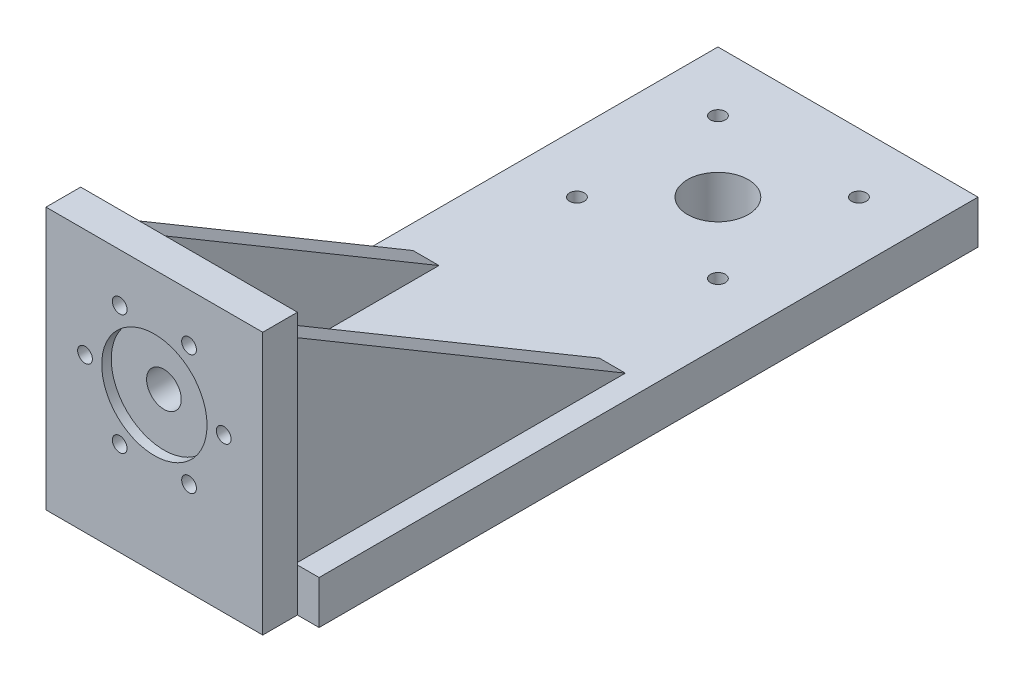
from build123d import *

# Parameters (mm, degrees)
SK_YAW_PLATE_W         = 50
SK_YAW_PLATE_H         = 60.5
SK_YAW_PLATE_R         = 1.7
SK_YAW_PLATE_R_2       = 4
YAW_PLATE_DEPTH        = 8
SK_YAW_PILOT_RECESS_R  = 12.15
YAW_PILOT_RECESS_DEPTH = 2.2
SK_ELBOW_PLATE_W       = 60
SK_ELBOW_PLATE_H       = 152
SK_ELBOW_PLATE_R       = 1.7
SK_ELBOW_PLATE_R_2     = 7
ELBOW_PLATE_DEPTH      = 10
GUSSET_FRONT_DEPTH     = 6
GUSSET_BACK_DEPTH      = 6


with BuildPart() as part:
    # SK_Yaw_Plate → Yaw_Plate (new body)
    with BuildSketch(Plane.XY.offset(-8)):
        with Locations((0, -5.25)):
            Rectangle(SK_YAW_PLATE_W, SK_YAW_PLATE_H)
        with Locations((16, 0)):
            Circle(SK_YAW_PLATE_R, mode=Mode.SUBTRACT)
        with Locations((8, 13.856406461)):
            Circle(SK_YAW_PLATE_R, mode=Mode.SUBTRACT)
        with Locations((-8, 13.856406461)):
            Circle(SK_YAW_PLATE_R, mode=Mode.SUBTRACT)
        with Locations((-16, 0)):
            Circle(SK_YAW_PLATE_R, mode=Mode.SUBTRACT)
        with Locations((-8, -13.856406461)):
            Circle(SK_YAW_PLATE_R, mode=Mode.SUBTRACT)
        with Locations((8, -13.856406461)):
            Circle(SK_YAW_PLATE_R, mode=Mode.SUBTRACT)
        Circle(SK_YAW_PLATE_R_2, mode=Mode.SUBTRACT)
    extrude(amount=YAW_PLATE_DEPTH)

    # SK_Yaw_Pilot_Recess → Yaw_Pilot_Recess (cut)
    with BuildSketch(Plane.XY):
        Circle(SK_YAW_PILOT_RECESS_R)
    extrude(amount=-YAW_PILOT_RECESS_DEPTH, mode=Mode.SUBTRACT)

    # SK_Elbow_Plate → Elbow_Plate (add)
    with BuildSketch(Plane(origin=(0, -35.5, 0), x_dir=(1, 0, 0), z_dir=(0, 1, 0))):
        with Locations((0, 84)):
            Rectangle(SK_ELBOW_PLATE_W, SK_ELBOW_PLATE_H)
        with Locations((16.263455967, 146.263455967)):
            Circle(SK_ELBOW_PLATE_R, mode=Mode.SUBTRACT)
        with Locations((-16.263455967, 146.263455967)):
            Circle(SK_ELBOW_PLATE_R, mode=Mode.SUBTRACT)
        with Locations((-16.263455967, 113.736544033)):
            Circle(SK_ELBOW_PLATE_R, mode=Mode.SUBTRACT)
        with Locations((16.263455967, 113.736544033)):
            Circle(SK_ELBOW_PLATE_R, mode=Mode.SUBTRACT)
        with Locations((0, 130)):
            Circle(SK_ELBOW_PLATE_R_2, mode=Mode.SUBTRACT)
    extrude(amount=ELBOW_PLATE_DEPTH)

    # SK_Gusset_Front → Gusset_Front (add)
    with BuildSketch(Plane(origin=(18.5, 0, 0), x_dir=(0, 0, -1), z_dir=(1, 0, 0))):
        Polygon((7.5, -26), (7.5, 20), (85, -26), align=None)
    extrude(amount=GUSSET_FRONT_DEPTH)

    # SK_Gusset_Back → Gusset_Back (add)
    with BuildSketch(Plane(origin=(-24.5, 0, 0), x_dir=(0, 0, -1), z_dir=(1, 0, 0))):
        Polygon((7.5, -26), (7.5, 20), (85, -26), align=None)
    extrude(amount=GUSSET_BACK_DEPTH)


solid = part.part
